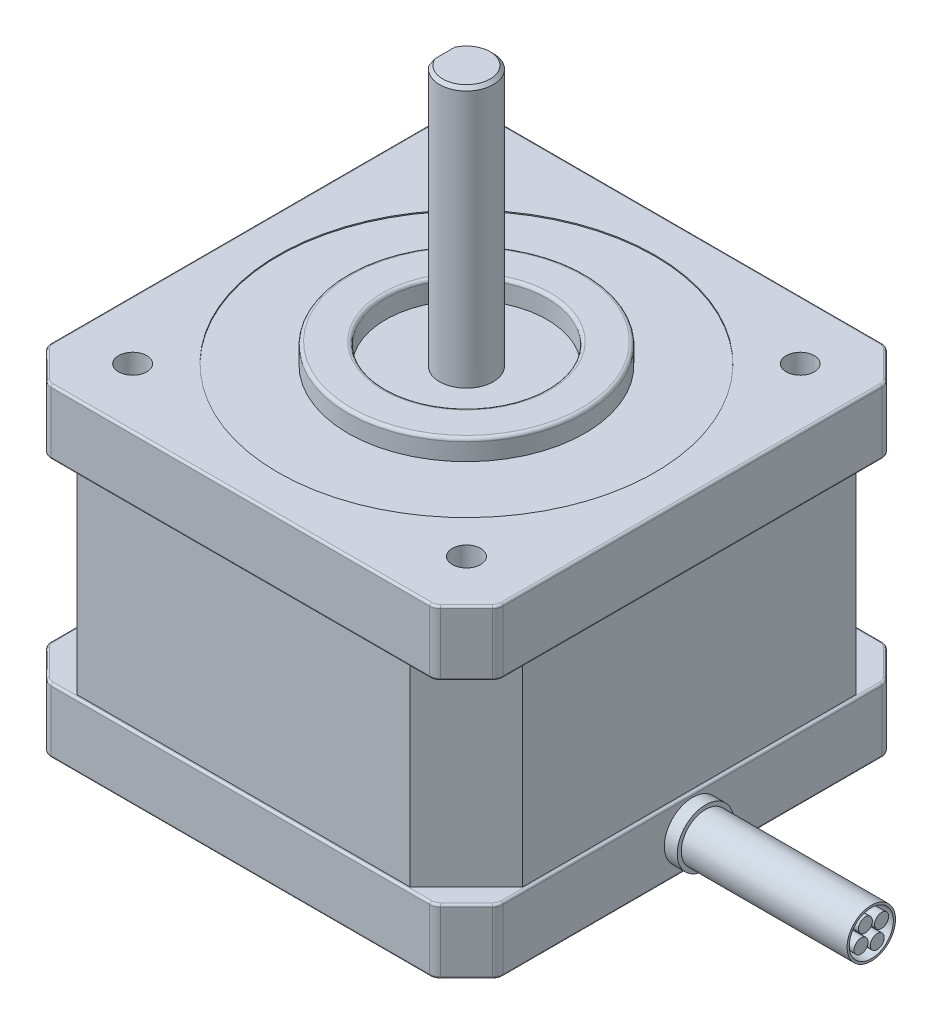
from build123d import *

# Parameters (mm, degrees)
SKETCH_1_W               = 42
SKETCH_1_H               = 42
EXTRUDE_1_DEPTH          = 30
CHAMFER_3_SIZE           = 3
SKETCH_2_R               = 11
EXTRUDE_2_DEPTH          = 1.8
SKETCH_3_R               = 2.5
EXTRUDE_3_DEPTH          = 24
SKETCH_4_OUTSIDE_W       = 60.054
SKETCH_4_OUTSIDE_H       = 60.054
CUT_EXTRUDE_1_DEPTH      = 18
FILLET_2_R               = 1
FILLET_3_R               = 0.2
CUT_EXTRUDE_START        = -15
CUT_EXTRUDE_5_DEPTH      = 15
CHAMFER_5_SIZE           = 0.3
CHAMFER_4_SIZE           = 0.5
SKETCH_6_R               = 1.3105
CUT_EXTRUDE_2_DEPTH      = 4.5
CUT_EXTRUDE_START_2      = -2
SKETCH_7_R               = 7.5
SKETCH_7_R_2             = 2.5
CUT_EXTRUDE_3_DEPTH      = 2
SKETCH_8_R               = 2.625
EXTRUDE_5_DEPTH          = 1.2
SKETCH_9_R               = 2.25
SKETCH_9_R_2             = 2.05
EXTRUDE_6_DEPTH          = 15.4
SKETCH_10_R              = 0.65
EXTRUDE_8_DEPTH          = 15.4
CUT_EXTRUDE_START_3      = -0.1
SKETCH_15_R              = 17.5
SKETCH_15_R_2            = 11
CUT_EXTRUDE_6_DEPTH      = 0.1
FILLET_4_R               = 0.3
PATTERN_CIRCULAR_3_COUNT = 4


with BuildPart() as part:
    # 草图1 → 凸台-拉伸1 (new body)
    with BuildSketch(Plane(origin=(0, 0, 0), x_dir=(1, 0, 0), z_dir=(0, 1, 0))):
        Rectangle(SKETCH_1_W, SKETCH_1_H)
    extrude(amount=EXTRUDE_1_DEPTH)

    # 倒角3
    chamfer_3_edges = [part.edges().sort_by_distance(p)[0] for p in [
        (-21, 15, -21),
        (21, 15, -21),
        (21, 15, 21),
        (-21, 15, 21),
    ]]
    chamfer(chamfer_3_edges, length=CHAMFER_3_SIZE)

    # 草图2 → 凸台-拉伸2 (add)
    with BuildSketch(Plane(origin=(0, 30, 0), x_dir=(1, 0, 0), z_dir=(0, 1, 0))):
        with Locations(Location((0, 0, 0), (0, 0, 270))):
            Circle(SKETCH_2_R)
    extrude(amount=EXTRUDE_2_DEPTH)

    # 草图3 → 凸台-拉伸3 (add)
    with BuildSketch(Plane(origin=(0, 30, 0), x_dir=(1, 0, 0), z_dir=(0, 1, 0))):
        with Locations(Location((0, 0, 0), (0, 0, 270))):
            Circle(SKETCH_3_R)
    extrude(amount=EXTRUDE_3_DEPTH)

    # 草图4 outside → 切除-拉伸1 (cut)
    with BuildSketch(Plane.XZ.offset(-6)):
        Rectangle(SKETCH_4_OUTSIDE_W, SKETCH_4_OUTSIDE_H)
        Polygon((15.471572875, 20.7), (-15.471572875, 20.7), (-20.7, 15.471572875), (-20.7, -15.471572875), (-15.471572875, -20.7), (15.471572875, -20.7), (20.7, -15.471572875), (20.7, 15.471572875), align=None, mode=Mode.SUBTRACT)
    extrude(amount=-CUT_EXTRUDE_1_DEPTH, mode=Mode.SUBTRACT)

    # 圆角2
    fillet_2_edges = [part.edges().sort_by_distance(p)[0] for p in [
        (-18, 3, -21),
        (18, 27, -21),
        (21, 27, 18),
        (21, 3, -18),
        (-18, 27, 21),
        (18, 3, 21),
        (-21, 27, -18),
        (-21, 3, 18),
        (-18, 27, -21),
        (-21, 3, -18),
        (-21, 27, 18),
        (-18, 3, 21),
        (18, 27, 21),
        (21, 3, 18),
        (21, 27, -18),
        (18, 3, -21),
    ]]
    fillet(fillet_2_edges, radius=FILLET_2_R)

    # 圆角3
    fillet_3_edges = [part.edges().sort_by_distance(p)[0] for p in [
        (21, 6, 0),
        (21, 0, 0),
        (0, 0, -21),
        (19.5, 0, -19.5),
        (19.5, 0, 19.5),
        (0, 0, 21),
        (-19.5, 0, 19.5),
        (-21, 0, 0),
        (-19.5, 0, -19.5),
        (-20.923879533, 0, -17.96846987),
        (-17.96846987, 0, -20.923879533),
        (17.96846987, 0, -20.923879533),
        (20.923879533, 0, -17.96846987),
        (-20.923879533, 0, 17.96846987),
        (-17.96846987, 0, 20.923879533),
        (17.96846987, 0, 20.923879533),
        (20.923879533, 0, 17.96846987),
        (19.5, 6, 19.5),
        (19.5, 6, -19.5),
        (0, 6, -21),
        (-19.5, 6, -19.5),
        (-21, 6, 0),
        (-19.5, 6, 19.5),
        (0, 6, 21),
        (-20.923879533, 6, -17.96846987),
        (-17.96846987, 6, -20.923879533),
        (17.96846987, 6, -20.923879533),
        (20.923879533, 6, -17.96846987),
        (-20.923879533, 6, 17.96846987),
        (-17.96846987, 6, 20.923879533),
        (17.96846987, 6, 20.923879533),
        (20.923879533, 6, 17.96846987),
        (0, 24, -21),
        (0, 30, -21),
        (21, 30, 0),
        (19.5, 30, -19.5),
        (-19.5, 30, -19.5),
        (-21, 30, 0),
        (-19.5, 30, 19.5),
        (0, 30, 21),
        (19.5, 30, 19.5),
        (-20.923879533, 30, 17.96846987),
        (-17.96846987, 30, 20.923879533),
        (17.96846987, 30, 20.923879533),
        (20.923879533, 30, 17.96846987),
        (17.96846987, 30, -20.923879533),
        (20.923879533, 30, -17.96846987),
        (-20.923879533, 30, -17.96846987),
        (-17.96846987, 30, -20.923879533),
        (-19.5, 24, -19.5),
        (0, 24, 21),
        (-19.5, 24, 19.5),
        (-21, 24, 0),
        (19.5, 24, -19.5),
        (21, 24, 0),
        (19.5, 24, 19.5),
        (-20.923879533, 24, 17.96846987),
        (-17.96846987, 24, 20.923879533),
        (17.96846987, 24, 20.923879533),
        (20.923879533, 24, 17.96846987),
        (17.96846987, 24, -20.923879533),
        (20.923879533, 24, -17.96846987),
        (-20.923879533, 24, -17.96846987),
        (-17.96846987, 24, -20.923879533),
    ]]
    fillet(fillet_3_edges, radius=FILLET_3_R)

    # 草图14 → 切除-拉伸5 (cut)
    with BuildSketch(Plane(origin=(0, 54, 0), x_dir=(1, 0, 0), z_dir=(0, 1, 0)).offset(CUT_EXTRUDE_START)):
        with BuildLine():
            Line((-2, 1.5), (-2, -1.5))
            ThreePointArc((-2, -1.5), (-2.5, 0), (-2, 1.5))
        make_face()
    extrude(amount=CUT_EXTRUDE_5_DEPTH, mode=Mode.SUBTRACT)

    # 倒角5
    chamfer_5_edges = [part.edges().sort_by_distance(p)[0] for p in [
        (2.236067977, 54, -1.118033989),
    ]]
    chamfer(chamfer_5_edges, length=CHAMFER_5_SIZE)

    # 倒角4
    chamfer_4_edges = [part.edges().sort_by_distance(p)[0] for p in [
        (-2, 39, 0),
    ]]
    chamfer(chamfer_4_edges, length=CHAMFER_4_SIZE - 0.0001)  # a hair under: the kernel refuses the full size

    # 草图6 → 切除-拉伸2 (cut)
    with BuildSketch(Plane(origin=(0, 30, 0), x_dir=(1, 0, 0), z_dir=(0, 1, 0))):
        with Locations(Location((-15.5, 15.5, 0), (0, 0, 270))):
            Circle(SKETCH_6_R)
        with Locations(Location((15.5, 15.5, 0), (0, 0, 90))):
            Circle(SKETCH_6_R)
        with Locations(Location((15.5, -15.5, 0), (0, 0, 270))):
            Circle(SKETCH_6_R)
        with Locations(Location((-15.5, -15.5, 0), (0, 0, 90))):
            Circle(SKETCH_6_R)
    extrude(amount=-CUT_EXTRUDE_2_DEPTH, mode=Mode.SUBTRACT)

    # 草图7 → 切除-拉伸3 (cut)
    with BuildSketch(Plane(origin=(0, 31.8, 0), x_dir=(1, 0, 0), z_dir=(0, 1, 0)).offset(CUT_EXTRUDE_START_2)):
        with Locations(Location((0, 0, 0), (0, 0, 270))):
            Circle(SKETCH_7_R)
        with Locations(Location((0, 0, 0), (0, 0, 143.130102354))):
            Circle(SKETCH_7_R_2, mode=Mode.SUBTRACT)
    extrude(amount=CUT_EXTRUDE_3_DEPTH, mode=Mode.SUBTRACT)

    # 草图8 → 凸台-拉伸5 (add)
    with BuildSketch(Plane(origin=(21, 0, 0), x_dir=(0, 0, -1), z_dir=(1, 0, 0))):
        with Locations(Location((0, 3, 0), (0, 0, 180))):
            Circle(SKETCH_8_R)
    extrude(amount=EXTRUDE_5_DEPTH)

    # 草图9 → 凸台-拉伸6 (add)
    with BuildSketch(Plane(origin=(22.2, 0, 0), x_dir=(0, 0, -1), z_dir=(1, 0, 0))):
        with Locations(Location((0, 3, 0), (0, 0, 180))):
            Circle(SKETCH_9_R)
        with Locations(Location((0, 3, 0), (0, 0, 180))):
            Circle(SKETCH_9_R_2, mode=Mode.SUBTRACT)
    extrude(amount=EXTRUDE_6_DEPTH)

    # 草图10 → 凸台-拉伸8 (add)
    with BuildSketch(Plane(origin=(22.2, 0, 0), x_dir=(0, 0, -1), z_dir=(1, 0, 0))):
        with Locations((0.952627944, 3.55)):
            Circle(SKETCH_10_R)
    extrude_8 = extrude(amount=EXTRUDE_8_DEPTH)

    # 草图15 → 切除-拉伸6 (cut)
    with BuildSketch(Plane(origin=(0, 30, 0), x_dir=(1, 0, 0), z_dir=(0, 1, 0)).offset(CUT_EXTRUDE_START_3)):
        with Locations(Location((0, 0, 0), (0, 0, 270))):
            Circle(SKETCH_15_R)
        with Locations(Location((0, 0, 0), (0, 0, 270))):
            Circle(SKETCH_15_R_2, mode=Mode.SUBTRACT)
    extrude(amount=CUT_EXTRUDE_6_DEPTH, mode=Mode.SUBTRACT)

    # 圆角4
    fillet_4_edges = [part.edges().sort_by_distance(p)[0] for p in [
        (0, 31.8, -11),
        (0, 31.8, -7.5),
    ]]
    fillet(fillet_4_edges, radius=FILLET_4_R)

    # 阵列(圆周)3: 凸台-拉伸8 ×4 about axis
    pattern_circular_3_axis = Axis((0, 3, 0), (1, 0, 0))
    for i in range(1, PATTERN_CIRCULAR_3_COUNT):
        add(extrude_8.rotate(pattern_circular_3_axis, i * 360 / PATTERN_CIRCULAR_3_COUNT))


solid = part.part
